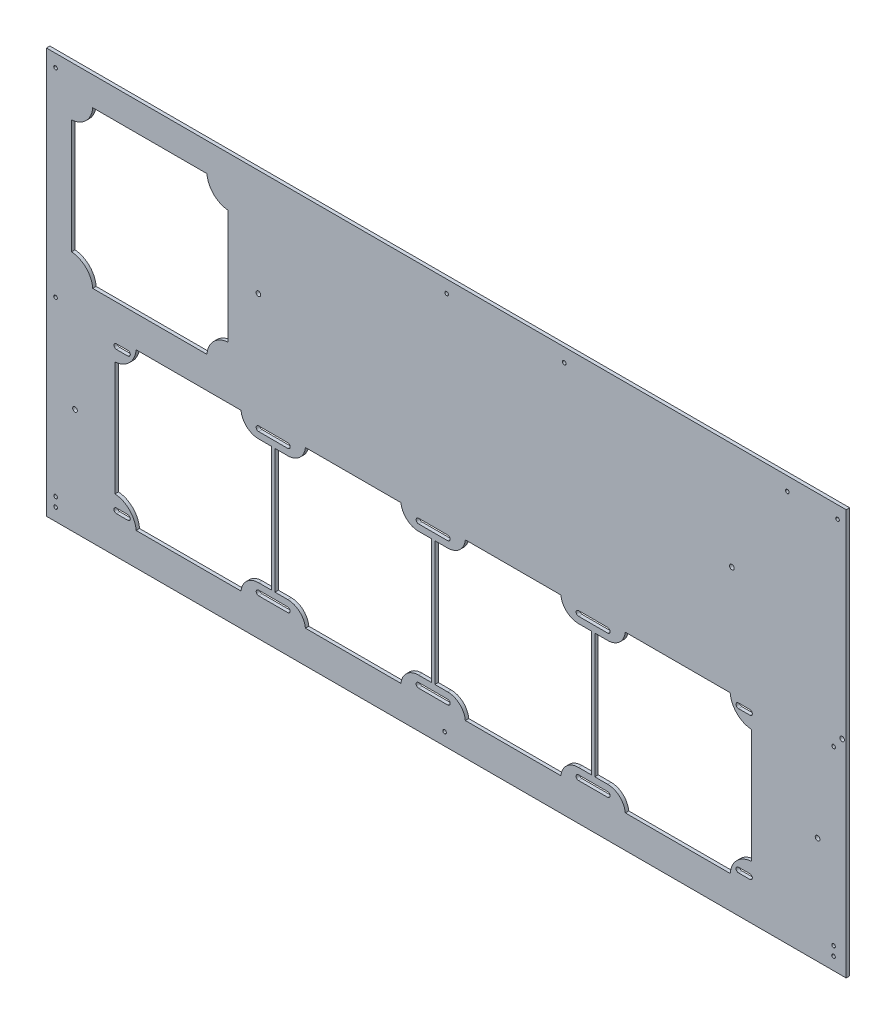
from build123d import *

# Parameters (mm, degrees)
BASE_FLANGE1_DEPTH = 3


# Read off the part's stored shape, not the designer's step: bottom.step
# Sheet-metal steps are written as plain solids
with BuildPart() as part:
    # Base-Flange1: sheet metal written as solids
    # Sketch1 → Base-Flange1 (new body)
    with BuildSketch(Plane.XY):
        Polygon((0, 351), (0, 347), (0, 0), (0, -4), (700, -4), (700, 0), (700, 347), (700, 351), align=None)
        with BuildLine():
            Line((605.75, 153.1), (615.75, 153.1))
            ThreePointArc((615.75, 153.1), (617.27027958, 153.72972042), (617.9, 155.25))
            ThreePointArc((617.9, 155.25), (617.27027958, 156.77027958), (615.75, 157.4))
            Line((615.75, 157.4), (605.75, 157.4))
            ThreePointArc((605.75, 157.4), (604.22972042, 156.77027958), (603.6, 155.25))
            ThreePointArc((603.6, 155.25), (604.22972042, 153.72972042), (605.75, 153.1))
        make_face(mode=Mode.SUBTRACT)
        with BuildLine():
            Line((615.75, 32.9), (605.75, 32.9))
            ThreePointArc((605.75, 32.9), (604.22972042, 32.27027958), (603.6, 30.75))
            ThreePointArc((603.6, 30.75), (604.22972042, 29.22972042), (605.75, 28.6))
            Line((605.75, 28.6), (615.75, 28.6))
            ThreePointArc((615.75, 28.6), (617.27027958, 29.22972042), (617.9, 30.75))
            ThreePointArc((617.9, 30.75), (617.27027958, 32.27027958), (615.75, 32.9))
        make_face(mode=Mode.SUBTRACT)
        with BuildLine():
            Line((71.25, 32.9), (61.25, 32.9))
            ThreePointArc((61.25, 32.9), (59.72972042, 32.27027958), (59.1, 30.75))
            ThreePointArc((59.1, 30.75), (59.72972042, 29.22972042), (61.25, 28.6))
            Line((61.25, 28.6), (71.25, 28.6))
            ThreePointArc((71.25, 28.6), (72.77027958, 29.22972042), (73.4, 30.75))
            ThreePointArc((73.4, 30.75), (72.77027958, 32.27027958), (71.25, 32.9))
        make_face(mode=Mode.SUBTRACT)
        with BuildLine():
            Line((185.75, 28.6), (211.25, 28.6))
            ThreePointArc((211.25, 28.6), (212.77027958, 29.22972042), (213.4, 30.75))
            ThreePointArc((213.4, 30.75), (212.77027958, 32.27027958), (211.25, 32.9))
            Line((211.25, 32.9), (185.75, 32.9))
            ThreePointArc((185.75, 32.9), (184.22972042, 32.27027958), (183.6, 30.75))
            ThreePointArc((183.6, 30.75), (184.22972042, 29.22972042), (185.75, 28.6))
        make_face(mode=Mode.SUBTRACT)
        with BuildLine():
            Line((325.75, 28.6), (351.25, 28.6))
            ThreePointArc((351.25, 28.6), (352.77027958, 29.22972042), (353.4, 30.75))
            ThreePointArc((353.4, 30.75), (352.77027958, 32.27027958), (351.25, 32.9))
            Line((351.25, 32.9), (325.75, 32.9))
            ThreePointArc((325.75, 32.9), (324.22972042, 32.27027958), (323.6, 30.75))
            ThreePointArc((323.6, 30.75), (324.22972042, 29.22972042), (325.75, 28.6))
        make_face(mode=Mode.SUBTRACT)
        with BuildLine():
            Line((465.75, 28.6), (491.25, 28.6))
            ThreePointArc((491.25, 28.6), (492.77027958, 29.22972042), (493.4, 30.75))
            ThreePointArc((493.4, 30.75), (492.77027958, 32.27027958), (491.25, 32.9))
            Line((491.25, 32.9), (465.75, 32.9))
            ThreePointArc((465.75, 32.9), (464.22972042, 32.27027958), (463.6, 30.75))
            ThreePointArc((463.6, 30.75), (464.22972042, 29.22972042), (465.75, 28.6))
        make_face(mode=Mode.SUBTRACT)
        with BuildLine():
            Line((491.25, 157.4), (465.75, 157.4))
            ThreePointArc((465.75, 157.4), (464.22972042, 156.77027958), (463.6, 155.25))
            ThreePointArc((463.6, 155.25), (464.22972042, 153.72972042), (465.75, 153.1))
            Line((465.75, 153.1), (491.25, 153.1))
            ThreePointArc((491.25, 153.1), (492.77027958, 153.72972042), (493.4, 155.25))
            ThreePointArc((493.4, 155.25), (492.77027958, 156.77027958), (491.25, 157.4))
        make_face(mode=Mode.SUBTRACT)
        with BuildLine():
            Line((351.25, 157.4), (325.75, 157.4))
            ThreePointArc((325.75, 157.4), (324.22972042, 156.77027958), (323.6, 155.25))
            ThreePointArc((323.6, 155.25), (324.22972042, 153.72972042), (325.75, 153.1))
            Line((325.75, 153.1), (351.25, 153.1))
            ThreePointArc((351.25, 153.1), (352.77027958, 153.72972042), (353.4, 155.25))
            ThreePointArc((353.4, 155.25), (352.77027958, 156.77027958), (351.25, 157.4))
        make_face(mode=Mode.SUBTRACT)
        with BuildLine():
            Line((211.25, 157.4), (185.75, 157.4))
            ThreePointArc((185.75, 157.4), (184.22972042, 156.77027958), (183.6, 155.25))
            ThreePointArc((183.6, 155.25), (184.22972042, 153.72972042), (185.75, 153.1))
            Line((185.75, 153.1), (211.25, 153.1))
            ThreePointArc((211.25, 153.1), (212.77027958, 153.72972042), (213.4, 155.25))
            ThreePointArc((213.4, 155.25), (212.77027958, 156.77027958), (211.25, 157.4))
        make_face(mode=Mode.SUBTRACT)
        with BuildLine():
            Line((61.25, 153.1), (71.25, 153.1))
            ThreePointArc((71.25, 153.1), (72.77027958, 153.72972042), (73.4, 155.25))
            ThreePointArc((73.4, 155.25), (72.77027958, 156.77027958), (71.25, 157.4))
            Line((71.25, 157.4), (61.25, 157.4))
            ThreePointArc((61.25, 157.4), (59.72972042, 156.77027958), (59.1, 155.25))
            ThreePointArc((59.1, 155.25), (59.72972042, 153.72972042), (61.25, 153.1))
        make_face(mode=Mode.SUBTRACT)
        with BuildLine():
            Line((548.5, 24.5), (598.5, 24.5))
            ThreePointArc((598.5, 24.5), (604.318145396, 37.181854604), (617, 43))
            Line((617, 43), (617, 143))
            ThreePointArc((617, 143), (604.318145396, 148.818145396), (598.5, 161.5))
            Line((598.5, 161.5), (548.5, 161.5))
            Line((548.5, 161.5), (506.67724862, 161.5))
            ThreePointArc((506.67724862, 161.5), (501.666333328, 151.521759717), (491.25, 147.5))
            Line((491.25, 147.5), (480, 147.5))
            Line((480, 147.5), (480, 93))
            Line((480, 93), (480, 38.5))
            Line((480, 38.5), (491.25, 38.5))
            ThreePointArc((491.25, 38.5), (501.666333328, 34.478240283), (506.67724862, 24.5))
            Line((506.67724862, 24.5), (548.5, 24.5))
        make_face(mode=Mode.SUBTRACT)
        with BuildLine():
            Line((477, 147.5), (465.75, 147.5))
            ThreePointArc((465.75, 147.5), (455.333666672, 151.521759717), (450.32275138, 161.5))
            Line((450.32275138, 161.5), (408.5, 161.5))
            Line((408.5, 161.5), (366.67724862, 161.5))
            ThreePointArc((366.67724862, 161.5), (361.666333328, 151.521759717), (351.25, 147.5))
            Line((351.25, 147.5), (340, 147.5))
            Line((340, 147.5), (340, 93))
            Line((340, 93), (340, 38.5))
            Line((340, 38.5), (351.25, 38.5))
            ThreePointArc((351.25, 38.5), (361.666333328, 34.478240283), (366.67724862, 24.5))
            Line((366.67724862, 24.5), (408.5, 24.5))
            Line((408.5, 24.5), (450.32275138, 24.5))
            ThreePointArc((450.32275138, 24.5), (455.333666672, 34.478240283), (465.75, 38.5))
            Line((465.75, 38.5), (477, 38.5))
            Line((477, 38.5), (477, 93))
            Line((477, 93), (477, 147.5))
        make_face(mode=Mode.SUBTRACT)
        with BuildLine():
            Line((337, 147.5), (325.75, 147.5))
            ThreePointArc((325.75, 147.5), (315.333666672, 151.521759717), (310.32275138, 161.5))
            Line((310.32275138, 161.5), (268.5, 161.5))
            Line((268.5, 161.5), (226.67724862, 161.5))
            ThreePointArc((226.67724862, 161.5), (221.666333328, 151.521759717), (211.25, 147.5))
            Line((211.25, 147.5), (200, 147.5))
            Line((200, 147.5), (200, 93))
            Line((200, 93), (200, 38.5))
            Line((200, 38.5), (211.25, 38.5))
            ThreePointArc((211.25, 38.5), (221.666333328, 34.478240283), (226.677248621, 24.5))
            Line((226.677248621, 24.5), (268.5, 24.5))
            Line((268.5, 24.5), (310.32275138, 24.5))
            ThreePointArc((310.32275138, 24.5), (315.333666672, 34.478240283), (325.75, 38.5))
            Line((325.75, 38.5), (337, 38.5))
            Line((337, 38.5), (337, 93))
            Line((337, 93), (337, 147.5))
        make_face(mode=Mode.SUBTRACT)
        with BuildLine():
            Line((197, 147.5), (185.75, 147.5))
            ThreePointArc((185.75, 147.5), (175.333666672, 151.521759717), (170.322751379, 161.5))
            Line((170.322751379, 161.5), (128.5, 161.5))
            Line((128.5, 161.5), (78.5, 161.5))
            ThreePointArc((78.5, 161.5), (72.681854604, 148.818145396), (60, 143))
            Line((60, 143), (60, 43))
            ThreePointArc((60, 43), (72.681854604, 37.181854604), (78.5, 24.5))
            Line((78.5, 24.5), (128.5, 24.5))
            Line((128.5, 24.5), (170.32275138, 24.5))
            ThreePointArc((170.32275138, 24.5), (175.333666672, 34.478240283), (185.75, 38.5))
            Line((185.75, 38.5), (197, 38.5))
            Line((197, 38.5), (197, 93))
            Line((197, 93), (197, 147.5))
        make_face(mode=Mode.SUBTRACT)
        with BuildLine():
            Line((90.5, 326), (40.5, 326))
            ThreePointArc((40.5, 326), (34.681854604, 313.318145396), (22, 307.5))
            Line((22, 307.5), (22, 257.5))
            Line((22, 257.5), (22, 207.5))
            ThreePointArc((22, 207.5), (34.681854604, 201.681854604), (40.5, 189))
            Line((40.5, 189), (90.5, 189))
            Line((90.5, 189), (140.5, 189))
            ThreePointArc((140.5, 189), (146.318145396, 201.681854604), (159, 207.5))
            Line((159, 207.5), (159, 257.5))
            Line((159, 257.5), (159, 307.5))
            ThreePointArc((159, 307.5), (146.318145396, 313.318145396), (140.5, 326))
            Line((140.5, 326), (90.5, 326))
        make_face(mode=Mode.SUBTRACT)
        with BuildLine():
            ThreePointArc((8, 5.4), (9.13137085, 5.86862915), (9.6, 7))
            add(Edge.make_bspline(
                [(9.6, 7), (9.599144796, 7.04043287), (9.597441601, 7.120957526), (9.583449234, 7.240793796), (9.561050517, 7.358924454), (9.529434689, 7.475353212), (9.46628832, 7.653854822), (9.347212978, 7.884948009), (9.139077952, 8.138958261), (8.885002964, 8.347138577), (8.630089511, 8.478661896), (8.39905452, 8.553787683), (8.201116482, 8.592917963), (8.067225889, 8.597632734), (8, 8.6)],
                knots=[0, 0, 0, 0, 0.048300702, 0.096193949, 0.143954901, 0.191860997, 0.24018718, 0.370073141, 0.500049556, 0.629923419, 0.759911847, 0.840126742, 0.919728328, 1, 1, 1, 1], degree=3))
            add(Edge.make_bspline(
                [(8, 8.6), (7.959573718, 8.599144722), (7.879058925, 8.597441312), (7.759232655, 8.583448437), (7.641102154, 8.561049558), (7.524664006, 8.529432932), (7.34615859, 8.466299068), (7.115054797, 8.347226567), (6.861043824, 8.139075913), (6.652847378, 7.885000304), (6.521328201, 7.630072821), (6.446216726, 7.399034858), (6.407083189, 7.201098259), (6.402367544, 7.067216771), (6.4, 7)],
                knots=[0, 0, 0, 0, 0.048292834, 0.09618217, 0.143943123, 0.191853023, 0.240186632, 0.370060815, 0.500049535, 0.629935723, 0.759912354, 0.840137637, 0.919739226, 1, 1, 1, 1], degree=3))
            add(Edge.make_bspline(
                [(6.4, 7), (6.400855204, 6.95956713), (6.402558399, 6.879042474), (6.416550766, 6.759206204), (6.438949483, 6.641075546), (6.470565311, 6.524646788), (6.53371168, 6.346145178), (6.652787022, 6.115051991), (6.860922048, 5.861041739), (7.114997036, 5.652861423), (7.369910489, 5.521338104), (7.60094548, 5.446212317), (7.798883518, 5.407082037), (7.932774111, 5.402367266), (8, 5.4)],
                knots=[0, 0, 0, 0, 0.048300702, 0.096193949, 0.143954901, 0.191860997, 0.24018718, 0.370073141, 0.500049556, 0.629923419, 0.759911847, 0.840126742, 0.919728328, 1, 1, 1, 1], degree=3))
        make_face(mode=Mode.SUBTRACT)
        with BuildLine():
            ThreePointArc((8, 13.4), (9.13137085, 13.86862915), (9.6, 15))
            add(Edge.make_bspline(
                [(9.6, 15), (9.599144796, 15.04043287), (9.597441601, 15.120957526), (9.583449234, 15.240793796), (9.561050517, 15.358924454), (9.529434689, 15.475353212), (9.46628832, 15.653854822), (9.347212978, 15.884948009), (9.139077952, 16.138958261), (8.885002964, 16.347138577), (8.630089511, 16.478661896), (8.39905452, 16.553787683), (8.201116482, 16.592917963), (8.067225889, 16.597632734), (8, 16.6)],
                knots=[0, 0, 0, 0, 0.048300702, 0.096193949, 0.143954901, 0.191860997, 0.24018718, 0.370073141, 0.500049556, 0.629923419, 0.759911847, 0.840126742, 0.919728328, 1, 1, 1, 1], degree=3))
            add(Edge.make_bspline(
                [(8, 16.6), (7.959573718, 16.599144722), (7.879058925, 16.597441312), (7.759232655, 16.583448437), (7.641102154, 16.561049558), (7.524664006, 16.529432932), (7.34615859, 16.466299068), (7.115054797, 16.347226567), (6.861043824, 16.139075913), (6.652847378, 15.885000304), (6.521328201, 15.630072821), (6.446216726, 15.399034858), (6.407083189, 15.201098259), (6.402367544, 15.067216771), (6.4, 15)],
                knots=[0, 0, 0, 0, 0.048292834, 0.09618217, 0.143943123, 0.191853023, 0.240186632, 0.370060815, 0.500049535, 0.629935723, 0.759912354, 0.840137637, 0.919739226, 1, 1, 1, 1], degree=3))
            add(Edge.make_bspline(
                [(6.4, 15), (6.400855204, 14.95956713), (6.402558399, 14.879042474), (6.416550766, 14.759206204), (6.438949483, 14.641075546), (6.470565311, 14.524646788), (6.53371168, 14.346145178), (6.652787022, 14.115051991), (6.860922048, 13.861041739), (7.114997036, 13.652861423), (7.369910489, 13.521338104), (7.60094548, 13.446212317), (7.798883518, 13.407082037), (7.932774111, 13.402367266), (8, 13.4)],
                knots=[0, 0, 0, 0, 0.048300702, 0.096193949, 0.143954901, 0.191860997, 0.24018718, 0.370073141, 0.500049556, 0.629923419, 0.759911847, 0.840126742, 0.919728328, 1, 1, 1, 1], degree=3))
        make_face(mode=Mode.SUBTRACT)
        with BuildLine():
            ThreePointArc((8, 164.4), (9.13137085, 164.86862915), (9.6, 166))
            add(Edge.make_bspline(
                [(9.6, 166), (9.599144796, 166.04043287), (9.597441601, 166.120957526), (9.583449234, 166.240793796), (9.561050517, 166.358924454), (9.529434689, 166.475353212), (9.46628832, 166.653854822), (9.347212978, 166.884948009), (9.139077952, 167.138958261), (8.885002964, 167.347138577), (8.630089511, 167.478661896), (8.39905452, 167.553787683), (8.201116482, 167.592917963), (8.067225889, 167.597632734), (8, 167.6)],
                knots=[0, 0, 0, 0, 0.048300702, 0.096193949, 0.143954901, 0.191860997, 0.24018718, 0.370073141, 0.500049556, 0.629923419, 0.759911847, 0.840126742, 0.919728328, 1, 1, 1, 1], degree=3))
            add(Edge.make_bspline(
                [(8, 167.6), (7.959573718, 167.599144722), (7.879058925, 167.597441312), (7.759232655, 167.583448437), (7.641102154, 167.561049558), (7.524664006, 167.529432932), (7.34615859, 167.466299068), (7.115054797, 167.347226567), (6.861043824, 167.139075913), (6.652847378, 166.885000304), (6.521328201, 166.630072821), (6.446216726, 166.399034858), (6.407083189, 166.201098259), (6.402367544, 166.067216771), (6.4, 166)],
                knots=[0, 0, 0, 0, 0.048292834, 0.09618217, 0.143943124, 0.191853023, 0.240186632, 0.370060815, 0.500049535, 0.629935723, 0.759912354, 0.840137637, 0.919739226, 1, 1, 1, 1], degree=3))
            add(Edge.make_bspline(
                [(6.4, 166), (6.400855204, 165.95956713), (6.402558399, 165.879042474), (6.416550766, 165.759206204), (6.438949483, 165.641075546), (6.470565311, 165.524646788), (6.53371168, 165.346145178), (6.652787022, 165.115051991), (6.860922048, 164.861041739), (7.114997036, 164.652861423), (7.369910489, 164.521338104), (7.60094548, 164.446212317), (7.798883518, 164.407082037), (7.932774111, 164.402367266), (8, 164.4)],
                knots=[0, 0, 0, 0, 0.048300702, 0.096193949, 0.143954901, 0.191860997, 0.24018718, 0.370073141, 0.500049556, 0.629923419, 0.759911847, 0.840126742, 0.919728328, 1, 1, 1, 1], degree=3))
        make_face(mode=Mode.SUBTRACT)
        with BuildLine():
            ThreePointArc((22.95, 89.5), (23.550431099, 88.050431099), (25, 87.45))
            ThreePointArc((25, 87.45), (26.449568901, 88.050431099), (27.05, 89.5))
            ThreePointArc((27.05, 89.5), (26.449568901, 90.949568901), (25, 91.55))
            ThreePointArc((25, 91.55), (23.550431099, 90.949568901), (22.95, 89.5))
        make_face(mode=Mode.SUBTRACT)
        with BuildLine():
            ThreePointArc((8, 338.4), (9.13137085, 338.86862915), (9.6, 340))
            add(Edge.make_bspline(
                [(9.6, 340), (9.599144796, 340.04043287), (9.597441601, 340.120957526), (9.583449234, 340.240793796), (9.561050517, 340.358924454), (9.529434689, 340.475353212), (9.46628832, 340.653854822), (9.347212978, 340.884948009), (9.139077952, 341.138958261), (8.885002964, 341.347138577), (8.630089511, 341.478661896), (8.39905452, 341.553787683), (8.201116482, 341.592917963), (8.067225889, 341.597632734), (8, 341.6)],
                knots=[0, 0, 0, 0, 0.048300702, 0.096193949, 0.143954901, 0.191860997, 0.24018718, 0.370073141, 0.500049556, 0.629923419, 0.759911847, 0.840126742, 0.919728328, 1, 1, 1, 1], degree=3))
            add(Edge.make_bspline(
                [(8, 341.6), (7.959573718, 341.599144722), (7.879058925, 341.597441312), (7.759232655, 341.583448437), (7.641102154, 341.561049558), (7.524664006, 341.529432932), (7.34615859, 341.466299068), (7.115054797, 341.347226567), (6.861043824, 341.139075913), (6.652847378, 340.885000304), (6.521328201, 340.630072821), (6.446216726, 340.399034858), (6.407083189, 340.201098259), (6.402367544, 340.067216771), (6.4, 340)],
                knots=[0, 0, 0, 0, 0.048292834, 0.09618217, 0.143943124, 0.191853023, 0.240186632, 0.370060815, 0.500049535, 0.629935723, 0.759912354, 0.840137637, 0.919739226, 1, 1, 1, 1], degree=3))
            add(Edge.make_bspline(
                [(6.4, 340), (6.400855204, 339.95956713), (6.402558399, 339.879042474), (6.416550766, 339.759206204), (6.438949483, 339.641075546), (6.470565311, 339.524646788), (6.53371168, 339.346145178), (6.652787022, 339.115051991), (6.860922048, 338.861041739), (7.114997036, 338.652861423), (7.369910489, 338.521338104), (7.60094548, 338.446212317), (7.798883517, 338.407082037), (7.932774111, 338.402367266), (8, 338.4)],
                knots=[0, 0, 0, 0, 0.048300702, 0.096193949, 0.143954901, 0.191860997, 0.24018718, 0.370073141, 0.500049556, 0.629923419, 0.759911847, 0.840126742, 0.919728328, 1, 1, 1, 1], degree=3))
        make_face(mode=Mode.SUBTRACT)
        with BuildLine():
            ThreePointArc((453.3, 337.45), (454.43137085, 337.91862915), (454.9, 339.05))
            add(Edge.make_bspline(
                [(454.9, 339.05), (454.899144796, 339.09043287), (454.897441601, 339.170957526), (454.883449234, 339.290793796), (454.861050517, 339.408924454), (454.829434689, 339.525353212), (454.76628832, 339.703854822), (454.647212978, 339.934948009), (454.439077952, 340.188958261), (454.185002963, 340.397138577), (453.930089511, 340.528661896), (453.69905452, 340.603787683), (453.501116482, 340.642917963), (453.367225889, 340.647632734), (453.3, 340.65)],
                knots=[0, 0, 0, 0, 0.048300702, 0.096193949, 0.143954901, 0.191860997, 0.24018718, 0.370073141, 0.500049556, 0.629923419, 0.759911847, 0.840126742, 0.919728328, 1, 1, 1, 1], degree=3))
            add(Edge.make_bspline(
                [(453.3, 340.65), (453.259573718, 340.649144722), (453.179058925, 340.647441312), (453.059232655, 340.633448437), (452.941102154, 340.611049558), (452.824664006, 340.579432932), (452.64615859, 340.516299068), (452.415054797, 340.397226567), (452.161043824, 340.189075913), (451.952847378, 339.935000304), (451.821328201, 339.680072821), (451.746216726, 339.449034858), (451.707083189, 339.251098259), (451.702367544, 339.117216771), (451.7, 339.05)],
                knots=[0, 0, 0, 0, 0.048292834, 0.09618217, 0.143943123, 0.191853023, 0.240186632, 0.370060815, 0.500049535, 0.629935723, 0.759912354, 0.840137637, 0.919739226, 1, 1, 1, 1], degree=3))
            add(Edge.make_bspline(
                [(451.7, 339.05), (451.700855204, 339.00956713), (451.702558399, 338.929042474), (451.716550766, 338.809206204), (451.738949483, 338.691075546), (451.770565311, 338.574646788), (451.83371168, 338.396145178), (451.952787022, 338.165051991), (452.160922048, 337.911041739), (452.414997036, 337.702861423), (452.669910489, 337.571338104), (452.90094548, 337.496212317), (453.098883518, 337.457082037), (453.232774111, 337.452367266), (453.3, 337.45)],
                knots=[0, 0, 0, 0, 0.048300702, 0.096193949, 0.143954901, 0.191860997, 0.24018718, 0.370073141, 0.500049556, 0.629923419, 0.759911847, 0.840126742, 0.919728328, 1, 1, 1, 1], degree=3))
        make_face(mode=Mode.SUBTRACT)
        with BuildLine():
            ThreePointArc((183.45, 257.5), (184.050431099, 256.050431099), (185.5, 255.45))
            ThreePointArc((185.5, 255.45), (186.949568901, 256.050431099), (187.55, 257.5))
            ThreePointArc((187.55, 257.5), (186.949568901, 258.949568901), (185.5, 259.55))
            ThreePointArc((185.5, 259.55), (184.050431099, 258.949568901), (183.45, 257.5))
        make_face(mode=Mode.SUBTRACT)
        with BuildLine():
            ThreePointArc((350.25, 338.4), (351.38137085, 338.86862915), (351.85, 340))
            add(Edge.make_bspline(
                [(351.85, 340), (351.849144796, 340.04043287), (351.847441601, 340.120957526), (351.833449234, 340.240793796), (351.811050517, 340.358924454), (351.779434689, 340.475353212), (351.71628832, 340.653854822), (351.597212978, 340.884948009), (351.389077952, 341.138958261), (351.135002963, 341.347138577), (350.880089511, 341.478661896), (350.649054519, 341.553787683), (350.451116482, 341.592917963), (350.317225889, 341.597632734), (350.25, 341.6)],
                knots=[0, 0, 0, 0, 0.048300702, 0.096193949, 0.143954901, 0.191860997, 0.24018718, 0.370073141, 0.500049556, 0.629923419, 0.759911847, 0.840126742, 0.919728328, 1, 1, 1, 1], degree=3))
            add(Edge.make_bspline(
                [(350.25, 341.6), (350.209573718, 341.599144722), (350.129058925, 341.597441312), (350.009232655, 341.583448437), (349.891102154, 341.561049558), (349.774664006, 341.529432932), (349.59615859, 341.466299068), (349.365054797, 341.347226567), (349.111043824, 341.139075913), (348.902847378, 340.885000304), (348.771328201, 340.630072821), (348.696216726, 340.399034858), (348.657083189, 340.201098259), (348.652367544, 340.067216771), (348.65, 340)],
                knots=[0, 0, 0, 0, 0.048292834, 0.09618217, 0.143943124, 0.191853023, 0.240186632, 0.370060815, 0.500049535, 0.629935723, 0.759912354, 0.840137637, 0.919739226, 1, 1, 1, 1], degree=3))
            add(Edge.make_bspline(
                [(348.65, 340), (348.650855204, 339.95956713), (348.652558399, 339.879042474), (348.666550766, 339.759206204), (348.688949483, 339.641075546), (348.720565311, 339.524646788), (348.78371168, 339.346145178), (348.902787022, 339.115051991), (349.110922048, 338.861041739), (349.364997036, 338.652861423), (349.619910489, 338.521338104), (349.85094548, 338.446212317), (350.048883518, 338.407082037), (350.182774111, 338.402367266), (350.25, 338.4)],
                knots=[0, 0, 0, 0, 0.048300702, 0.096193949, 0.143954901, 0.191860997, 0.24018718, 0.370073141, 0.500049556, 0.629923419, 0.759911847, 0.840126742, 0.919728328, 1, 1, 1, 1], degree=3))
        make_face(mode=Mode.SUBTRACT)
        with BuildLine():
            ThreePointArc((692.5, 338.4), (693.63137085, 338.86862915), (694.1, 340))
            add(Edge.make_bspline(
                [(694.1, 340), (694.099144796, 340.04043287), (694.097441601, 340.120957526), (694.083449234, 340.240793797), (694.061050517, 340.358924454), (694.029434689, 340.475353212), (693.96628832, 340.653854822), (693.847212978, 340.884948009), (693.639077952, 341.138958261), (693.385002964, 341.347138577), (693.130089511, 341.478661896), (692.89905452, 341.553787683), (692.701116482, 341.592917963), (692.567225889, 341.597632734), (692.5, 341.6)],
                knots=[0, 0, 0, 0, 0.048300702, 0.096193949, 0.143954901, 0.191860997, 0.24018718, 0.370073141, 0.500049556, 0.629923419, 0.759911847, 0.840126742, 0.919728328, 1, 1, 1, 1], degree=3))
            add(Edge.make_bspline(
                [(692.5, 341.6), (692.459573718, 341.599144722), (692.379058925, 341.597441312), (692.259232655, 341.583448437), (692.141102154, 341.561049558), (692.024664006, 341.529432932), (691.84615859, 341.466299068), (691.615054797, 341.347226567), (691.361043824, 341.139075913), (691.152847378, 340.885000304), (691.021328201, 340.630072821), (690.946216726, 340.399034858), (690.907083189, 340.201098259), (690.902367544, 340.067216771), (690.9, 340)],
                knots=[0, 0, 0, 0, 0.048292834, 0.09618217, 0.143943124, 0.191853023, 0.240186632, 0.370060815, 0.500049535, 0.629935723, 0.759912354, 0.840137637, 0.919739226, 1, 1, 1, 1], degree=3))
            add(Edge.make_bspline(
                [(690.9, 340), (690.900855204, 339.95956713), (690.902558399, 339.879042474), (690.916550766, 339.759206204), (690.938949483, 339.641075546), (690.970565311, 339.524646788), (691.03371168, 339.346145178), (691.152787022, 339.115051991), (691.360922048, 338.861041739), (691.614997036, 338.652861423), (691.869910489, 338.521338104), (692.10094548, 338.446212317), (692.298883517, 338.407082037), (692.432774111, 338.402367266), (692.5, 338.4)],
                knots=[0, 0, 0, 0, 0.048300702, 0.096193949, 0.143954901, 0.191860997, 0.24018718, 0.370073141, 0.500049556, 0.629923419, 0.759911847, 0.840126742, 0.919728328, 1, 1, 1, 1], degree=3))
        make_face(mode=Mode.SUBTRACT)
        with BuildLine():
            ThreePointArc((648.5, 337.45), (649.63137085, 337.91862915), (650.1, 339.05))
            add(Edge.make_bspline(
                [(650.1, 339.05), (650.099144796, 339.09043287), (650.097441601, 339.170957526), (650.083449234, 339.290793797), (650.061050517, 339.408924454), (650.029434689, 339.525353212), (649.96628832, 339.703854822), (649.847212978, 339.934948009), (649.639077952, 340.188958261), (649.385002964, 340.397138577), (649.130089511, 340.528661896), (648.89905452, 340.603787683), (648.701116482, 340.642917963), (648.567225889, 340.647632734), (648.5, 340.65)],
                knots=[0, 0, 0, 0, 0.048300702, 0.096193949, 0.143954901, 0.191860997, 0.24018718, 0.370073141, 0.500049556, 0.629923419, 0.759911847, 0.840126742, 0.919728328, 1, 1, 1, 1], degree=3))
            add(Edge.make_bspline(
                [(648.5, 340.65), (648.459573718, 340.649144722), (648.379058925, 340.647441312), (648.259232655, 340.633448437), (648.141102154, 340.611049558), (648.024664006, 340.579432932), (647.84615859, 340.516299068), (647.615054797, 340.397226567), (647.361043824, 340.189075913), (647.152847378, 339.935000304), (647.021328201, 339.680072821), (646.946216726, 339.449034858), (646.907083189, 339.251098259), (646.902367544, 339.117216771), (646.9, 339.05)],
                knots=[0, 0, 0, 0, 0.048292834, 0.09618217, 0.143943123, 0.191853023, 0.240186632, 0.370060815, 0.500049535, 0.629935723, 0.759912354, 0.840137637, 0.919739226, 1, 1, 1, 1], degree=3))
            add(Edge.make_bspline(
                [(646.9, 339.05), (646.900855204, 339.00956713), (646.902558399, 338.929042474), (646.916550766, 338.809206204), (646.938949483, 338.691075546), (646.970565311, 338.574646788), (647.03371168, 338.396145178), (647.152787022, 338.165051991), (647.360922048, 337.911041739), (647.614997036, 337.702861423), (647.869910489, 337.571338104), (648.10094548, 337.496212317), (648.298883518, 337.457082037), (648.432774111, 337.452367266), (648.5, 337.45)],
                knots=[0, 0, 0, 0, 0.048300702, 0.096193949, 0.143954901, 0.191860997, 0.24018718, 0.370073141, 0.500049556, 0.629923419, 0.759911847, 0.840126742, 0.919728328, 1, 1, 1, 1], degree=3))
        make_face(mode=Mode.SUBTRACT)
        with BuildLine():
            ThreePointArc((689, 164.4), (690.13137085, 164.86862915), (690.6, 166))
            add(Edge.make_bspline(
                [(690.6, 166), (690.599144796, 166.04043287), (690.597441601, 166.120957526), (690.583449234, 166.240793797), (690.561050517, 166.358924454), (690.529434689, 166.475353212), (690.46628832, 166.653854822), (690.347212978, 166.884948009), (690.139077952, 167.138958261), (689.885002964, 167.347138577), (689.630089511, 167.478661896), (689.39905452, 167.553787683), (689.201116482, 167.592917963), (689.067225889, 167.597632734), (689, 167.6)],
                knots=[0, 0, 0, 0, 0.048300702, 0.096193949, 0.143954901, 0.191860997, 0.24018718, 0.370073141, 0.500049556, 0.629923419, 0.759911847, 0.840126742, 0.919728328, 1, 1, 1, 1], degree=3))
            add(Edge.make_bspline(
                [(689, 167.6), (688.959573718, 167.599144722), (688.879058925, 167.597441312), (688.759232655, 167.583448437), (688.641102154, 167.561049558), (688.524664006, 167.529432932), (688.34615859, 167.466299068), (688.115054797, 167.347226567), (687.861043824, 167.139075913), (687.652847378, 166.885000304), (687.521328201, 166.630072821), (687.446216726, 166.399034858), (687.407083189, 166.201098259), (687.402367544, 166.067216771), (687.4, 166)],
                knots=[0, 0, 0, 0, 0.048292834, 0.09618217, 0.143943124, 0.191853023, 0.240186632, 0.370060815, 0.500049535, 0.629935723, 0.759912354, 0.840137637, 0.919739226, 1, 1, 1, 1], degree=3))
            add(Edge.make_bspline(
                [(687.4, 166), (687.400855204, 165.95956713), (687.402558399, 165.879042474), (687.416550766, 165.759206204), (687.438949483, 165.641075546), (687.470565311, 165.524646788), (687.53371168, 165.346145178), (687.652787022, 165.115051991), (687.860922048, 164.861041739), (688.114997037, 164.652861423), (688.369910489, 164.521338104), (688.60094548, 164.446212317), (688.798883518, 164.407082037), (688.932774111, 164.402367266), (689, 164.4)],
                knots=[0, 0, 0, 0, 0.048300702, 0.096193949, 0.143954901, 0.191860997, 0.24018718, 0.370073141, 0.500049556, 0.629923419, 0.759911847, 0.840126742, 0.919728328, 1, 1, 1, 1], degree=3))
        make_face(mode=Mode.SUBTRACT)
        with BuildLine():
            ThreePointArc((597.95, 257.5), (598.550431099, 256.050431099), (600, 255.45))
            ThreePointArc((600, 255.45), (601.449568901, 256.050431099), (602.05, 257.5))
            ThreePointArc((602.05, 257.5), (601.449568901, 258.949568901), (600, 259.55))
            ThreePointArc((600, 259.55), (598.550431099, 258.949568901), (597.95, 257.5))
        make_face(mode=Mode.SUBTRACT)
        with BuildLine():
            ThreePointArc((698.5, 175.5), (697.914213562, 176.914213562), (696.5, 177.5))
            ThreePointArc((696.5, 177.5), (695.085786438, 176.914213562), (694.5, 175.5))
            ThreePointArc((694.5, 175.5), (695.085786438, 174.085786438), (696.5, 173.5))
            ThreePointArc((696.5, 173.5), (697.914213562, 174.085786438), (698.5, 175.5))
        make_face(mode=Mode.SUBTRACT)
        with BuildLine():
            ThreePointArc((689, 13.4), (690.13137085, 13.86862915), (690.6, 15))
            add(Edge.make_bspline(
                [(690.6, 15), (690.599144796, 15.04043287), (690.597441601, 15.120957526), (690.583449234, 15.240793796), (690.561050517, 15.358924454), (690.529434689, 15.475353212), (690.46628832, 15.653854822), (690.347212978, 15.884948009), (690.139077952, 16.138958261), (689.885002964, 16.347138577), (689.630089511, 16.478661896), (689.39905452, 16.553787683), (689.201116482, 16.592917963), (689.067225889, 16.597632734), (689, 16.6)],
                knots=[0, 0, 0, 0, 0.048300702, 0.096193949, 0.143954901, 0.191860997, 0.24018718, 0.370073141, 0.500049556, 0.629923419, 0.759911847, 0.840126742, 0.919728328, 1, 1, 1, 1], degree=3))
            add(Edge.make_bspline(
                [(689, 16.6), (688.959573718, 16.599144722), (688.879058925, 16.597441312), (688.759232655, 16.583448437), (688.641102154, 16.561049558), (688.524664006, 16.529432932), (688.34615859, 16.466299068), (688.115054797, 16.347226567), (687.861043824, 16.139075913), (687.652847378, 15.885000304), (687.521328201, 15.630072821), (687.446216726, 15.399034858), (687.407083189, 15.201098259), (687.402367544, 15.067216771), (687.4, 15)],
                knots=[0, 0, 0, 0, 0.048292834, 0.09618217, 0.143943124, 0.191853023, 0.240186632, 0.370060815, 0.500049535, 0.629935723, 0.759912354, 0.840137637, 0.919739226, 1, 1, 1, 1], degree=3))
            add(Edge.make_bspline(
                [(687.4, 15), (687.400855204, 14.95956713), (687.402558399, 14.879042474), (687.416550766, 14.759206204), (687.438949483, 14.641075546), (687.470565311, 14.524646788), (687.53371168, 14.346145178), (687.652787022, 14.115051991), (687.860922048, 13.861041739), (688.114997037, 13.652861423), (688.369910489, 13.521338104), (688.60094548, 13.446212317), (688.798883518, 13.407082037), (688.932774111, 13.402367266), (689, 13.4)],
                knots=[0, 0, 0, 0, 0.048300702, 0.096193949, 0.143954901, 0.191860997, 0.24018718, 0.370073141, 0.500049556, 0.629923419, 0.759911847, 0.840126742, 0.919728328, 1, 1, 1, 1], degree=3))
        make_face(mode=Mode.SUBTRACT)
        with BuildLine():
            ThreePointArc((672.95, 89.5), (673.550431099, 88.050431099), (675, 87.45))
            ThreePointArc((675, 87.45), (676.449568901, 88.050431099), (677.05, 89.5))
            ThreePointArc((677.05, 89.5), (676.449568901, 90.949568901), (675, 91.55))
            ThreePointArc((675, 91.55), (673.550431099, 90.949568901), (672.95, 89.5))
        make_face(mode=Mode.SUBTRACT)
        with BuildLine():
            ThreePointArc((689, 5.4), (690.13137085, 5.86862915), (690.6, 7))
            add(Edge.make_bspline(
                [(690.6, 7), (690.599144796, 7.04043287), (690.597441601, 7.120957526), (690.583449234, 7.240793796), (690.561050517, 7.358924454), (690.529434689, 7.475353212), (690.46628832, 7.653854822), (690.347212978, 7.884948009), (690.139077952, 8.138958261), (689.885002964, 8.347138577), (689.630089511, 8.478661896), (689.39905452, 8.553787683), (689.201116482, 8.592917963), (689.067225889, 8.597632734), (689, 8.6)],
                knots=[0, 0, 0, 0, 0.048300702, 0.096193949, 0.143954901, 0.191860997, 0.24018718, 0.370073141, 0.500049556, 0.629923419, 0.759911847, 0.840126742, 0.919728328, 1, 1, 1, 1], degree=3))
            add(Edge.make_bspline(
                [(689, 8.6), (688.959573718, 8.599144722), (688.879058925, 8.597441312), (688.759232655, 8.583448437), (688.641102154, 8.561049558), (688.524664006, 8.529432932), (688.34615859, 8.466299068), (688.115054797, 8.347226567), (687.861043824, 8.139075913), (687.652847378, 7.885000304), (687.521328201, 7.630072821), (687.446216726, 7.399034858), (687.407083189, 7.201098259), (687.402367544, 7.067216771), (687.4, 7)],
                knots=[0, 0, 0, 0, 0.048292834, 0.09618217, 0.143943124, 0.191853023, 0.240186632, 0.370060815, 0.500049535, 0.629935723, 0.759912354, 0.840137637, 0.919739226, 1, 1, 1, 1], degree=3))
            add(Edge.make_bspline(
                [(687.4, 7), (687.400855204, 6.95956713), (687.402558399, 6.879042474), (687.416550766, 6.759206204), (687.438949483, 6.641075546), (687.470565311, 6.524646788), (687.53371168, 6.346145178), (687.652787022, 6.115051991), (687.860922048, 5.861041739), (688.114997037, 5.652861423), (688.369910489, 5.521338104), (688.60094548, 5.446212317), (688.798883518, 5.407082037), (688.932774111, 5.402367266), (689, 5.4)],
                knots=[0, 0, 0, 0, 0.048300702, 0.096193949, 0.143954901, 0.191860997, 0.24018718, 0.370073141, 0.500049556, 0.629923419, 0.759911847, 0.840126742, 0.919728328, 1, 1, 1, 1], degree=3))
        make_face(mode=Mode.SUBTRACT)
        with BuildLine():
            ThreePointArc((348.5, 5.4), (349.63137085, 5.86862915), (350.1, 7))
            add(Edge.make_bspline(
                [(350.1, 7), (350.099144796, 7.04043287), (350.097441601, 7.120957526), (350.083449234, 7.240793797), (350.061050517, 7.358924454), (350.029434689, 7.475353212), (349.96628832, 7.653854822), (349.847212978, 7.884948009), (349.639077952, 8.138958261), (349.385002964, 8.347138577), (349.130089511, 8.478661896), (348.89905452, 8.553787683), (348.701116482, 8.592917963), (348.567225889, 8.597632734), (348.5, 8.6)],
                knots=[0, 0, 0, 0, 0.048300702, 0.096193949, 0.143954901, 0.191860997, 0.24018718, 0.370073141, 0.500049556, 0.629923419, 0.759911847, 0.840126742, 0.919728328, 1, 1, 1, 1], degree=3))
            add(Edge.make_bspline(
                [(348.5, 8.6), (348.459573718, 8.599144722), (348.379058925, 8.597441312), (348.259232655, 8.583448437), (348.141102154, 8.561049558), (348.024664006, 8.529432932), (347.84615859, 8.466299068), (347.615054797, 8.347226567), (347.361043824, 8.139075913), (347.152847378, 7.885000304), (347.021328201, 7.630072821), (346.946216726, 7.399034858), (346.907083189, 7.201098259), (346.902367544, 7.067216771), (346.9, 7)],
                knots=[0, 0, 0, 0, 0.048292834, 0.09618217, 0.143943123, 0.191853023, 0.240186632, 0.370060815, 0.500049535, 0.629935723, 0.759912354, 0.840137637, 0.919739226, 1, 1, 1, 1], degree=3))
            add(Edge.make_bspline(
                [(346.9, 7), (346.900855204, 6.95956713), (346.902558399, 6.879042474), (346.916550766, 6.759206204), (346.938949483, 6.641075546), (346.970565311, 6.524646788), (347.03371168, 6.346145178), (347.152787022, 6.115051991), (347.360922048, 5.861041739), (347.614997036, 5.652861423), (347.869910489, 5.521338104), (348.10094548, 5.446212317), (348.298883518, 5.407082037), (348.432774111, 5.402367266), (348.5, 5.4)],
                knots=[0, 0, 0, 0, 0.048300702, 0.096193949, 0.143954901, 0.191860997, 0.24018718, 0.370073141, 0.500049556, 0.629923419, 0.759911847, 0.840126742, 0.919728328, 1, 1, 1, 1], degree=3))
        make_face(mode=Mode.SUBTRACT)
    extrude(amount=-BASE_FLANGE1_DEPTH)


solid = part.part
